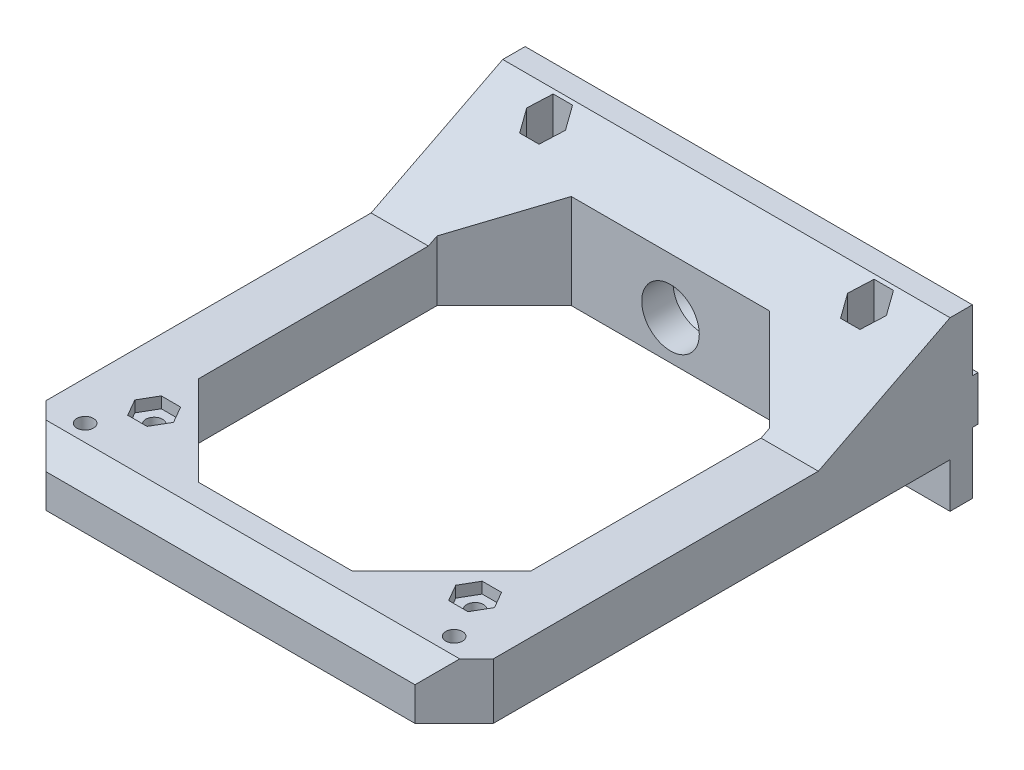
from build123d import *

# Parameters (mm, degrees)
BOSS_EXTRUDE1_DEPTH     = 40
SKETCH2_W               = 10
SKETCH2_H               = 10
BOSS_EXTRUDE2_DEPTH     = 80
SKETCH3_R               = 1.5
CUT_EXTRUDE1_DEPTH      = 48.749345545
SKETCH4_R               = 1.5
BOSS_EXTRUDE3_DEPTH     = 10
CHAMFER1_SIZE           = 23.551326066
CHAMFER1_SIZE_2         = 12
CHAMFER2_SIZE           = 4
CHAMFER3_SIZE           = 4
CHAMFER4_SIZE           = 12
SKETCH7_R               = 1.5
CUT_EXTRUDE3_DEPTH      = 104.330973091
CUT_EXTRUDE2_DEPTH      = 103.553839519
CUT_EXTRUDE2_DEPTH_BACK = 2
CHAMFER5_SIZE           = 7
SKETCH8_R               = 5.15
CUT_EXTRUDE4_DEPTH      = 5.5
SKETCH9_R               = 2.75
CUT_EXTRUDE5_DEPTH      = 95.417371283
CHAMFER6_SIZE           = 2.5


# Some blends are built 0.0001 mm under size
with BuildPart() as part:
    # Sketch1 → Boss-Extrude1 (new, symmetric)
    with BuildSketch(Plane(origin=(0, 0, 0), x_dir=(0, 0, -1), z_dir=(1, 0, 0))):
        Polygon((0, 4), (0, 15), (-4, 15), (-4, -15), (0, -15), (0, -4), (1, -4), (1, 4), align=None)
    extrude(amount=BOSS_EXTRUDE1_DEPTH, both=True)

    # Sketch2 → Boss-Extrude2 (add)
    with BuildSketch(Plane.ZY.offset(40)):
        with Locations((9, -2)):
            Rectangle(SKETCH2_W, SKETCH2_H)
    extrude(amount=-BOSS_EXTRUDE2_DEPTH)

    # Sketch3 → Cut-Extrude1 (cut, through all)
    with BuildSketch(Plane.XZ.offset(7)):
        with Locations(Location((-28.7, 7.55, 0), (0, 0, 270))):
            Circle(SKETCH3_R)
        with Locations(Location((28.7, 7.55, 0), (0, 0, 270))):
            Circle(SKETCH3_R)
    extrude(amount=-CUT_EXTRUDE1_DEPTH, mode=Mode.SUBTRACT)

    # Sketch4 → Boss-Extrude3 (add)
    with BuildSketch(Plane.XZ.offset(7)):
        Polygon((-40, 14), (-29.75, 14), (-29.75, 72.7), (-25.75, 72.7), (-25.75, 84.7), (25.75, 84.7), (25.75, 72.7), (29.75, 72.7), (29.75, 14), (40, 14), (40, 92.7), (-40, 92.7), align=None)
        with Locations(Location((-28.7, 77.65, 0), (0, 0, 270))):
            Circle(SKETCH4_R, mode=Mode.SUBTRACT)
        with Locations(Location((28.7, 77.65, 0), (0, 0, 90))):
            Circle(SKETCH4_R, mode=Mode.SUBTRACT)
    extrude(amount=-BOSS_EXTRUDE3_DEPTH)

    # Chamfer1
    # the kernel refuses this chamfer: 23.551326066, 12 mm, written as the material it adds along each edge
    with BuildSketch(Plane(origin=(-40, 3, 4), x_dir=(0, -0.017531984409911095, 0.9998463029499337), z_dir=(1, 0, 0))) as chamfer1_piece_1_section:
        Polygon((CHAMFER1_SIZE * 0.999846302953, -CHAMFER1_SIZE * 0.01753198441), (-CHAMFER1_SIZE_2 * 0.0175319844099, -CHAMFER1_SIZE_2 * 0.99984630295), (0, 0), align=None)
    chamfer1_piece_1 = extrude(amount=80, mode=Mode.PRIVATE)
    chamfer1_piece_1 = split(chamfer1_piece_1, bisect_by=Plane(origin=(-34.875, 4.887878827, 14), z_dir=(0, 0, 1)), keep=Keep.TOP, mode=Mode.PRIVATE)
    chamfer1_piece_1 = split(chamfer1_piece_1, bisect_by=Plane(origin=(-29.75, 4.887878827, 19.058840597), z_dir=(-1, 0, 0)), keep=Keep.TOP, mode=Mode.PRIVATE)
    add(chamfer1_piece_1)
    with BuildSketch(Plane(origin=(-40, 3, 4), x_dir=(0, -0.017531984409911095, 0.9998463029499337), z_dir=(1, 0, 0))) as chamfer1_piece_2_section:
        Polygon((CHAMFER1_SIZE * 0.999846302953, -CHAMFER1_SIZE * 0.01753198441), (-CHAMFER1_SIZE_2 * 0.0175319844099, -CHAMFER1_SIZE_2 * 0.99984630295), (0, 0), align=None)
    chamfer1_piece_2 = extrude(amount=80, mode=Mode.PRIVATE)
    chamfer1_piece_2 = split(chamfer1_piece_2, bisect_by=Plane(origin=(-34.907327213, 7.791187199, 14), z_dir=(0, 0, -1)), keep=Keep.TOP, mode=Mode.PRIVATE)
    chamfer1_piece_2 = split(chamfer1_piece_2, bisect_by=Plane(origin=(-29.75, 7.791187199, 8.24071688), z_dir=(-1, 0, 0)), keep=Keep.TOP, mode=Mode.PRIVATE)
    chamfer1_piece_2 = chamfer1_piece_2 - Plane(origin=(-28.7, 7.791187199, 7.55), x_dir=(0, 0, -1), z_dir=(0, -1, 0)) * Cylinder(1.5, 255, mode=Mode.PRIVATE)
    chamfer1_piece_2 = split(chamfer1_piece_2, bisect_by=Plane(origin=(-34.907327213, 15, 8.24071688), z_dir=(0, -1, 0)), keep=Keep.TOP, mode=Mode.PRIVATE)
    add(chamfer1_piece_2)
    with BuildSketch(Plane(origin=(-40, 3, 4), x_dir=(0, -0.017531984409911095, 0.9998463029499337), z_dir=(1, 0, 0))) as chamfer1_piece_3_section:
        Polygon((CHAMFER1_SIZE * 0.999846302953, -CHAMFER1_SIZE * 0.01753198441), (-CHAMFER1_SIZE_2 * 0.0175319844099, -CHAMFER1_SIZE_2 * 0.99984630295), (0, 0), align=None)
    chamfer1_piece_3 = extrude(amount=80, mode=Mode.PRIVATE)
    chamfer1_piece_3 = split(chamfer1_piece_3, bisect_by=Plane(origin=(3.218e-06, 7.789653484, 14), z_dir=(0, 0, -1)), keep=Keep.TOP, mode=Mode.PRIVATE)
    chamfer1_piece_3 = split(chamfer1_piece_3, bisect_by=Plane(origin=(-29.75, 7.789653484, 8.251914963), z_dir=(1, 0, 0)), keep=Keep.TOP, mode=Mode.PRIVATE)
    chamfer1_piece_3 = split(chamfer1_piece_3, bisect_by=Plane(origin=(29.75, 7.789653484, 8.251914963), z_dir=(-1, 0, 0)), keep=Keep.TOP, mode=Mode.PRIVATE)
    chamfer1_piece_3 = chamfer1_piece_3 - Plane(origin=(28.7, 7.789653484, 7.55), x_dir=(0, 0, -1), z_dir=(0, -1, 0)) * Cylinder(1.5, 255, mode=Mode.PRIVATE)
    chamfer1_piece_3 = chamfer1_piece_3 - Plane(origin=(-28.7, 7.789653484, 7.55), x_dir=(0, 0, -1), z_dir=(0, -1, 0)) * Cylinder(1.5, 255, mode=Mode.PRIVATE)
    chamfer1_piece_3 = split(chamfer1_piece_3, bisect_by=Plane(origin=(3.218e-06, 15, 8.251914963), z_dir=(0, -1, 0)), keep=Keep.TOP, mode=Mode.PRIVATE)
    add(chamfer1_piece_3)
    with BuildSketch(Plane(origin=(-40, 3, 4), x_dir=(0, -0.017531984409911095, 0.9998463029499337), z_dir=(1, 0, 0))) as chamfer1_piece_4_section:
        Polygon((CHAMFER1_SIZE * 0.999846302953, -CHAMFER1_SIZE * 0.01753198441), (-CHAMFER1_SIZE_2 * 0.0175319844099, -CHAMFER1_SIZE_2 * 0.99984630295), (0, 0), align=None)
    chamfer1_piece_4 = extrude(amount=80, mode=Mode.PRIVATE)
    chamfer1_piece_4 = split(chamfer1_piece_4, bisect_by=Plane(origin=(34.875, 4.887878827, 14), z_dir=(0, 0, 1)), keep=Keep.TOP, mode=Mode.PRIVATE)
    chamfer1_piece_4 = split(chamfer1_piece_4, bisect_by=Plane(origin=(29.75, 4.887878827, 19.058840597), z_dir=(1, 0, 0)), keep=Keep.TOP, mode=Mode.PRIVATE)
    add(chamfer1_piece_4)
    with BuildSketch(Plane(origin=(-40, 3, 4), x_dir=(0, -0.017531984409911095, 0.9998463029499337), z_dir=(1, 0, 0))) as chamfer1_piece_5_section:
        Polygon((CHAMFER1_SIZE * 0.999846302953, -CHAMFER1_SIZE * 0.01753198441), (-CHAMFER1_SIZE_2 * 0.0175319844099, -CHAMFER1_SIZE_2 * 0.99984630295), (0, 0), align=None)
    chamfer1_piece_5 = extrude(amount=80, mode=Mode.PRIVATE)
    chamfer1_piece_5 = split(chamfer1_piece_5, bisect_by=Plane(origin=(34.907327332, 7.791187313, 14), z_dir=(0, 0, -1)), keep=Keep.TOP, mode=Mode.PRIVATE)
    chamfer1_piece_5 = split(chamfer1_piece_5, bisect_by=Plane(origin=(29.75, 7.791187313, 8.240716948), z_dir=(1, 0, 0)), keep=Keep.TOP, mode=Mode.PRIVATE)
    chamfer1_piece_5 = chamfer1_piece_5 - Plane(origin=(28.7, 7.791187313, 7.55), x_dir=(0, 0, -1), z_dir=(0, -1, 0)) * Cylinder(1.5, 255, mode=Mode.PRIVATE)
    chamfer1_piece_5 = split(chamfer1_piece_5, bisect_by=Plane(origin=(34.907327332, 15, 8.240716948), z_dir=(0, -1, 0)), keep=Keep.TOP, mode=Mode.PRIVATE)
    add(chamfer1_piece_5)

    # Chamfer2
    chamfer2_edges = [part.edges().sort_by_distance(p)[0] for p in [
        (-29.75, -2, 72.7),
        (29.75, -2, 72.7),
    ]]
    chamfer(chamfer2_edges, length=CHAMFER2_SIZE - 0.0001)  # a hair under: the kernel refuses the full size

    # Chamfer3
    chamfer3_edges = [part.edges().sort_by_distance(p)[0] for p in [
        (0, 3, 92.7),
    ]]
    chamfer(chamfer3_edges, length=CHAMFER3_SIZE)

    # Chamfer4
    chamfer4_edges = [part.edges().sort_by_distance(p)[0] for p in [
        (-25.75, -2, 84.7),
        (25.75, -2, 84.7),
        (29.75, 1.452372753, 14),
        (-29.75, 1.452372753, 14),
    ]]
    chamfer(chamfer4_edges, length=CHAMFER4_SIZE - 0.0001)  # a hair under: the kernel refuses the full size

    # Sketch7 → Cut-Extrude3 (cut, through all)
    with BuildSketch(Plane.XZ.offset(7)):
        with Locations(Location((-33, 85.7, 0), (0, 0, 270))):
            Circle(SKETCH7_R)
        with Locations(Location((33, 85.7, 0), (0, 0, 270))):
            Circle(SKETCH7_R)
    extrude(amount=-CUT_EXTRUDE3_DEPTH, mode=Mode.SUBTRACT)

    # Sketch5 → Cut-Extrude2 (cut, two sides: drawn at the far end of the back side and taken through both)
    with BuildSketch(Plane(origin=(0, 3, 0), x_dir=(1, 0, 0), z_dir=(0, 1, 0)).offset(-CUT_EXTRUDE2_DEPTH_BACK)):
        Polygon((32.164101615, -77.65), (30.432050808, -80.65), (26.967949192, -80.65), (25.235898385, -77.65), (26.967949192, -74.65), (30.432050808, -74.65), align=None)
        Polygon((-26.967949192, -74.65), (-30.432050808, -74.65), (-32.164101615, -77.65), (-30.432050808, -80.65), (-26.967949192, -80.65), (-25.235898385, -77.65), align=None)
        Polygon((-25.235898385, -7.55), (-26.967949192, -10.55), (-30.432050808, -10.55), (-32.164101615, -7.55), (-30.432050808, -4.55), (-26.967949192, -4.55), align=None)
        Polygon((26.967949192, -10.55), (30.432050808, -10.55), (32.164101615, -7.55), (30.432050808, -4.55), (26.967949192, -4.55), (25.235898385, -7.55), align=None)
    extrude(amount=CUT_EXTRUDE2_DEPTH + CUT_EXTRUDE2_DEPTH_BACK, mode=Mode.SUBTRACT)

    # Chamfer5
    chamfer5_edges = [part.edges().sort_by_distance(p)[0] for p in [
        (-40, -4, 92.7),
        (40, -4, 92.7),
    ]]
    chamfer(chamfer5_edges, length=CHAMFER5_SIZE)

    # Sketch8 → Cut-Extrude4 (cut)
    with BuildSketch(Plane.XY.offset(14)):
        Circle(SKETCH8_R)
    extrude(amount=-CUT_EXTRUDE4_DEPTH, mode=Mode.SUBTRACT)

    # Sketch9 → Cut-Extrude5 (cut, through all)
    with BuildSketch(Plane.XY.offset(8.5)):
        Circle(SKETCH9_R)
    extrude(amount=-CUT_EXTRUDE5_DEPTH, mode=Mode.SUBTRACT)

    # Chamfer6
    # the kernel refuses this chamfer: 2.5 mm, written as the material it takes off along each edge
    with BuildSketch(Plane(origin=(0, 0, 8.5), x_dir=(1, 0, 0), z_dir=(0, -1, 0))) as chamfer6_piece_1_section:
        Polygon((2.75, -CHAMFER6_SIZE), (2.75 + CHAMFER6_SIZE, 0), (2.75, 0), align=None)
    chamfer6_piece_1 = revolve(axis=Axis((0, 0, 8.5), (0, 0, 1)), mode=Mode.PRIVATE)
    chamfer6_piece_1 = chamfer6_piece_1 & Plane(origin=(0, 0, 7.19466401), x_dir=(1, 0, 0), z_dir=(0, 0, 1)) * Cylinder(5.15, 21, mode=Mode.PRIVATE)
    add(chamfer6_piece_1, mode=Mode.SUBTRACT)


solid = part.part
